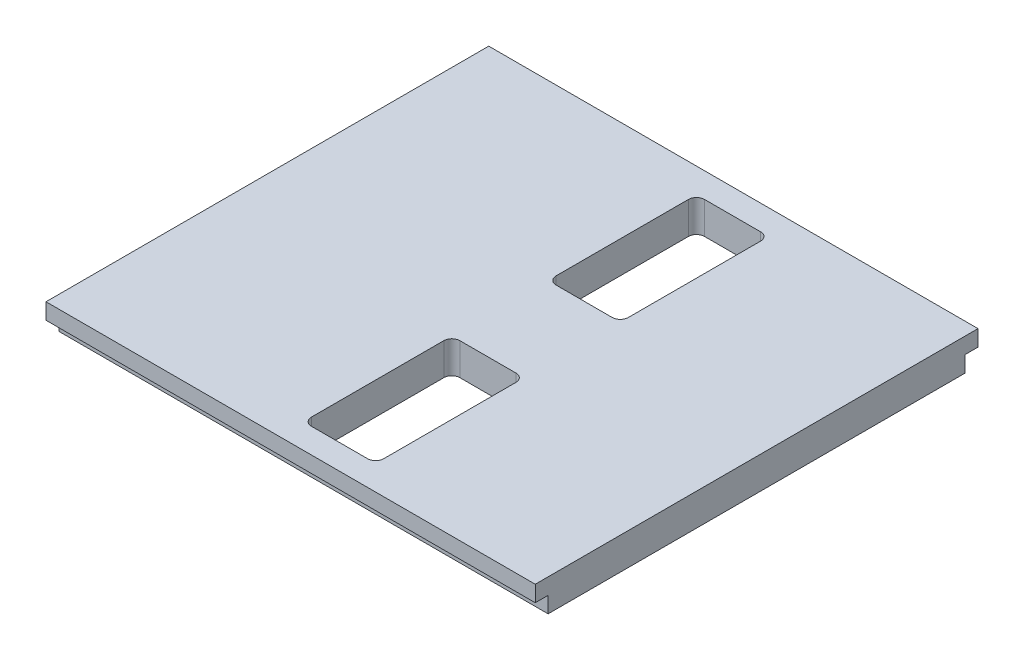
from build123d import *

# Parameters (mm, degrees)
SKETCH1_W           = 175.26
SKETCH1_H           = 12.7
BOSS_EXTRUDE1_DEPTH = 96.8375
SKETCH2_W           = 5.08
SKETCH2_H           = 6.35
CUT_EXTRUDE1_DEPTH  = 213.67191875
CUT_EXTRUDE2_DEPTH  = 6.35
SKETCH5_W           = 28.575
SKETCH5_H           = 58.7375
CUT_EXTRUDE4_DEPTH  = 132.216646453
FILLET1_R           = 3.175


with BuildPart() as part:
    # Sketch1 → Boss-Extrude1 (new, symmetric)
    with BuildSketch(Plane(origin=(0, 0, 0), x_dir=(0, 0, -1), z_dir=(1, 0, 0))):
        Rectangle(SKETCH1_W, SKETCH1_H)
    extrude(amount=BOSS_EXTRUDE1_DEPTH, both=True)

    # Sketch2 → Cut-Extrude1 (cut, through all)
    with BuildSketch(Plane(origin=(96.8375, 0, 0), x_dir=(0, 0, -1), z_dir=(1, 0, 0))):
        with Locations((-85.09, -3.175)):
            Rectangle(SKETCH2_W, SKETCH2_H)
        with Locations((85.09, -3.175)):
            Rectangle(SKETCH2_W, SKETCH2_H)
    extrude(amount=-CUT_EXTRUDE1_DEPTH, mode=Mode.SUBTRACT)

    # Sketch3 → Cut-Extrude2 (cut)
    with BuildSketch(Plane(origin=(0, -6.35, 0), x_dir=(1, 0, 0), z_dir=(0, 1, 0))):
        with BuildLine():
            Line((28.448, 11.2395), (41.402, 11.2395))
            ThreePointArc((41.402, 11.2395), (44.704, 7.9375), (41.402, 4.6355))
            Line((41.402, 4.6355), (41.402, -4.6355))
            ThreePointArc((41.402, -4.6355), (44.704, -7.9375), (41.402, -11.2395))
            Line((41.402, -11.2395), (28.448, -11.2395))
            ThreePointArc((28.448, -11.2395), (25.146, -7.9375), (28.448, -4.6355))
            Line((28.448, -4.6355), (28.448, 4.6355))
            ThreePointArc((28.448, 4.6355), (25.146, 7.9375), (28.448, 11.2395))
        make_face()
        with BuildLine():
            Line((-22.352, 11.2395), (-9.398, 11.2395))
            ThreePointArc((-9.398, 11.2395), (-6.096, 7.9375), (-9.398, 4.6355))
            Line((-9.398, 4.6355), (-9.398, -4.6355))
            ThreePointArc((-9.398, -4.6355), (-6.096, -7.9375), (-9.398, -11.2395))
            Line((-9.398, -11.2395), (-22.352, -11.2395))
            ThreePointArc((-22.352, -11.2395), (-25.654, -7.9375), (-22.352, -4.6355))
            Line((-22.352, -4.6355), (-22.352, 4.6355))
            ThreePointArc((-22.352, 4.6355), (-25.654, 7.9375), (-22.352, 11.2395))
        make_face()
    extrude(amount=CUT_EXTRUDE2_DEPTH, mode=Mode.SUBTRACT)

    # Sketch5 → Cut-Extrude4 (cut, through all)
    with BuildSketch(Plane(origin=(0, 6.35, 0), x_dir=(1, 0, 0), z_dir=(0, 1, 0))):
        with Locations((9.525, -48.41875)):
            Rectangle(SKETCH5_W, SKETCH5_H)
        with Locations((9.525, 48.41875)):
            Rectangle(SKETCH5_W, SKETCH5_H)
    extrude(amount=-CUT_EXTRUDE4_DEPTH, mode=Mode.SUBTRACT)

    # Fillet1
    fillet1_edges = [part.edges().sort_by_distance(p)[0] for p in [
        (23.8125, 0, -19.05),
        (23.8125, 0, -77.7875),
        (-4.7625, 0, -77.7875),
        (-4.7625, 0, -19.05),
        (23.8125, 0, 77.7875),
        (23.8125, 0, 19.05),
        (-4.7625, 0, 19.05),
        (-4.7625, 0, 77.7875),
    ]]
    fillet(fillet1_edges, radius=FILLET1_R)


solid = part.part
